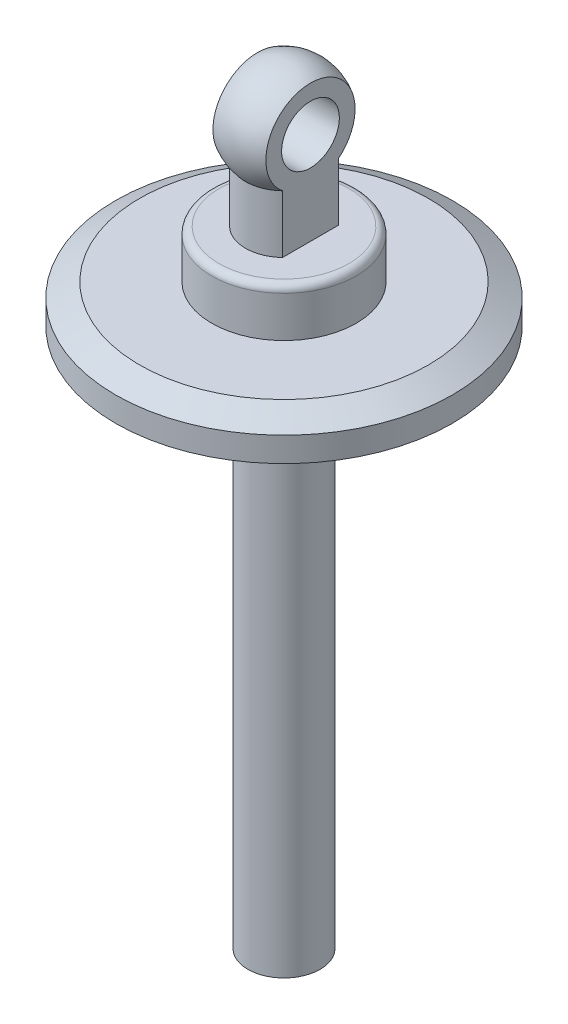
from build123d import *

# Parameters (mm, degrees)
CHAFL_N1_SIZE         = 5
CHAFL_N2_SIZE         = 5
CHAFL_N2_SIZE2        = 2.886751346
REDONDEO1_R           = 1.5
CORTAR_EXTRUIR1_DEPTH = 40
CROQUIS3_R            = 6
CORTAR_EXTRUIR2_DEPTH = 40


with BuildPart() as part:
    # Croquis1 → Revolución1 (revolve)
    with BuildSketch(Plane.XY, mode=Mode.PRIVATE) as revoluci_n1_sk:
        with BuildLine():
            Line((0, -80), (0, 80))
            ThreePointArc((0, 80), (-9.848857802, 73.599492356), (-8, 62))
            Line((-8, 62), (-8, 50))
            Line((-8, 50), (-15, 50))
            Line((-15, 50), (-15, 40))
            Line((-15, 40), (-35, 40))
            Line((-35, 40), (-35, 32))
            Line((-35, 32), (-10, 32))
            Line((-10, 32), (-10, 30))
            Line((-10, 30), (-14.5, 30))
            Line((-14.5, 30), (-14.5, 20))
            Line((-14.5, 20), (-7.5, 20))
            Line((-7.5, 20), (-7.5, -80))
            Line((-7.5, -80), (0, -80))
        make_face()
    revolve(revoluci_n1_sk.sketch.rotate(Axis((0, -80, 0), (0, 1, 0)), 180), axis=Axis((0, -80, 0), (0, 1, 0)))

    # Chaflán1
    # the kernel refuses this chamfer: 5 mm, written as the material it takes off along each edge
    with BuildSketch(Plane(origin=(0, 30, 0), x_dir=(1, 0, 0), z_dir=(0, 0, 1))) as chafl_n1_piece_1_section:
        Polygon((14.5 - CHAFL_N1_SIZE, 0), (14.5, -CHAFL_N1_SIZE), (14.5, 0), align=None)
    chafl_n1_piece_1 = revolve(axis=Axis((0, 30, 0), (0, 1, 0)), mode=Mode.PRIVATE)
    chafl_n1_piece_1 = chafl_n1_piece_1 - Plane(origin=(0, 27.252174823, 0), x_dir=(1, 0, 0), z_dir=(0, -1, 0)) * Cylinder(10, 58, mode=Mode.PRIVATE)
    add(chafl_n1_piece_1, mode=Mode.SUBTRACT)

    # Chaflán2
    chafl_n2_edges = [part.edges().sort_by_distance(p)[0] for p in [
        (-35, 40, 0),
    ]]
    chafl_n2_side = [part.faces().sort_by_distance(p)[0] for p in [
        (-15.989949494, 40, 0),
    ]]
    chamfer(chafl_n2_edges, length=CHAFL_N2_SIZE, length2=CHAFL_N2_SIZE2, reference=chafl_n2_side[0])

    # Redondeo1
    redondeo1_edges = [part.edges().sort_by_distance(p)[0] for p in [
        (-15, 50, 0),
    ]]
    fillet(redondeo1_edges, radius=REDONDEO1_R)

    # Croquis2 → Cortar-Extruir1 (cut, symmetric)
    with BuildSketch(Plane.XY):
        Polygon((-13.5, 50), (-5.5, 50), (-5.5, 83.023482793), (-17.692901936, 83.023482793), (-17.692901936, 50), align=None)
    cortar_extruir1 = extrude(amount=CORTAR_EXTRUIR1_DEPTH, both=True, mode=Mode.SUBTRACT)

    # Simetría1: Cortar-Extruir1 across plane
    add(cortar_extruir1.mirror(Plane(origin=(0, 0, 0), x_dir=(0, 0, 1), z_dir=(1, 0, 0))), mode=Mode.SUBTRACT)

    # Croquis3 → Cortar-Extruir2 (cut, symmetric)
    with BuildSketch(Plane(origin=(5.5, 0, 0), x_dir=(0, 0, -1), z_dir=(1, 0, 0))):
        with Locations(Location((0, 69.222222222, 0), (0, 0, 270))):
            Circle(CROQUIS3_R)
    extrude(amount=CORTAR_EXTRUIR2_DEPTH, both=True, mode=Mode.SUBTRACT)


solid = part.part
